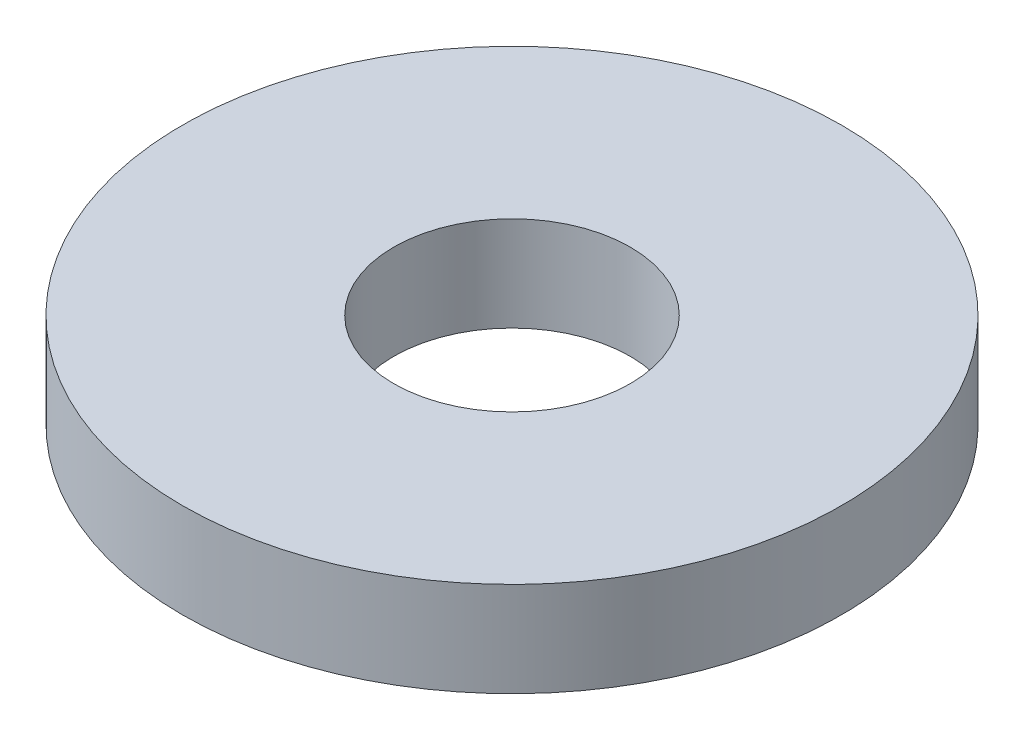
from build123d import *

# Parameters (mm, degrees)
SKETCH1_R           = 97.5
BOSS_EXTRUDE1_DEPTH = 28
SKETCH2_R           = 35
CUT_EXTRUDE1_DEPTH  = 141.700035537


with BuildPart() as part:
    # Sketch1 → Boss-Extrude1 (new body)
    with BuildSketch(Plane(origin=(0, 0, 0), x_dir=(1, 0, 0), z_dir=(0, 1, 0))):
        Circle(SKETCH1_R)
    extrude(amount=BOSS_EXTRUDE1_DEPTH)

    # Sketch2 → Cut-Extrude1 (cut, through all)
    with BuildSketch(Plane(origin=(0, 0, 0), x_dir=(1, 0, 0), z_dir=(0, 1, 0))):
        Circle(SKETCH2_R)
    extrude(amount=CUT_EXTRUDE1_DEPTH, mode=Mode.SUBTRACT)


solid = part.part
